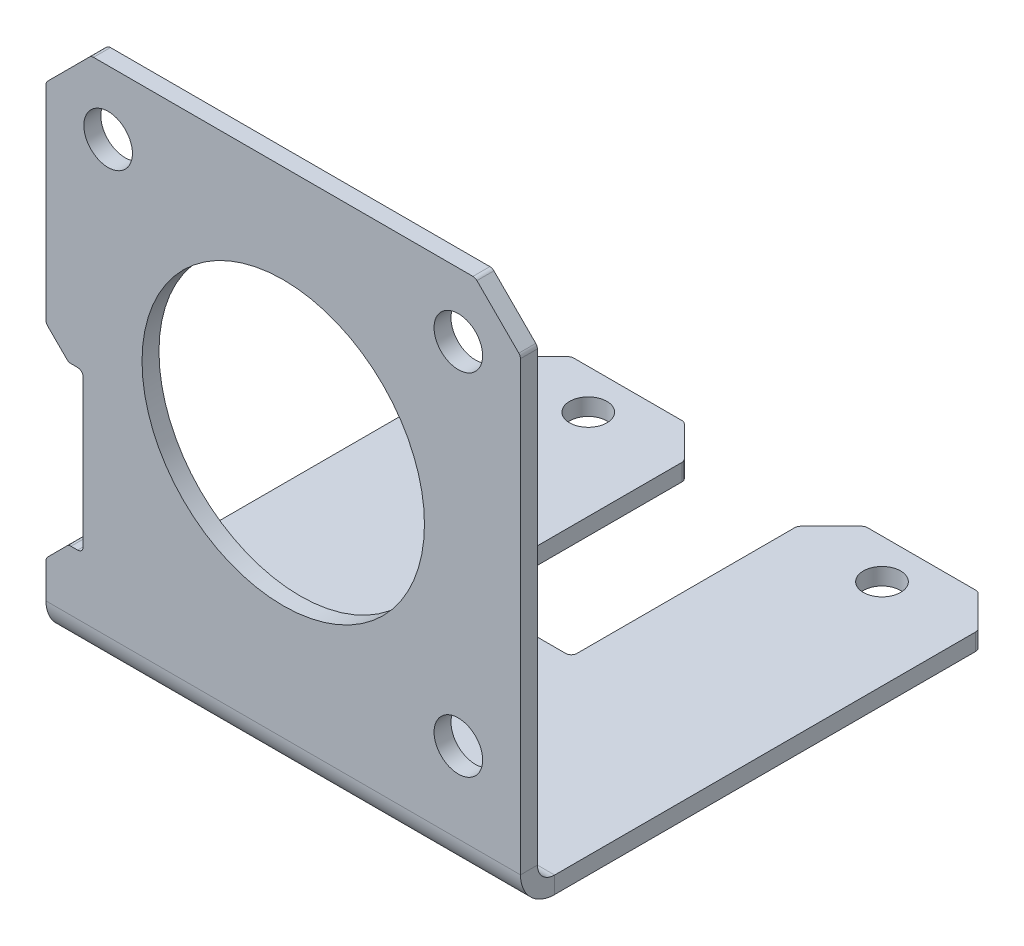
from build123d import *

# Parameters (mm, degrees)
BASE_FLANGE1_DEPTH           = 1.5
EDGE_FLANGE1_STRIP_W         = 9.048
EDGE_FLANGE1_STRIP_H         = 1.5
EDGE_FLANGE1_STRIP_CUT_DEPTH = 42
EDGE_FLANGE1_DEPTH           = 42
SKETCH9_R                    = 12.5
CUT_EXTRUDE1_DEPTH           = 1.5
SKETCH10_R                   = 2.15
CUT_EXTRUDE2_DEPTH           = 67.221899701
SKETCH11_R                   = 1.65
CUT_EXTRUDE3_DEPTH           = 67.221899701
CHAMFER1_SIZE                = 4
CHAMFER2_SIZE                = 3
SKETCH12_W                   = 3.295995972
SKETCH12_H                   = 14
CUT_EXTRUDE4_DEPTH           = 67.221899701
CHAMFER3_SIZE                = 2
SKETCH13_R                   = 1.25
CUT_EXTRUDE5_DEPTH           = 67.221899701
FILLET1_R                    = 0.5


# Sheet-metal steps are written as plain solids
with BuildPart() as part:
    # Sketch1 → Base-Flange1 (new body)
    with BuildSketch(Plane(origin=(0, 0, 0), x_dir=(1, 0, 0), z_dir=(0, 1, 0))):
        Polygon((-21, 43.5), (-5, 43.5), (-5, 20.5), (5, 20.5), (5, 43.5), (21, 43.5), (21, 0), (-21, 0), align=None)
    extrude(amount=-BASE_FLANGE1_DEPTH)

    # Edge-Flange1 strip (across the edge) → Edge-Flange1 strip cut (cut)
    with BuildSketch(Plane(origin=(-21, 0, 0), x_dir=(0, 0, -1), z_dir=(1, 0, 0))):
        with Locations((-1.5, -0.75)):
            Rectangle(EDGE_FLANGE1_STRIP_W, EDGE_FLANGE1_STRIP_H)
    extrude(amount=EDGE_FLANGE1_STRIP_CUT_DEPTH, mode=Mode.SUBTRACT)

    # Edge-Flange1 section (across the edge) → Edge-Flange1 (add)
    with BuildSketch(Plane(origin=(-21, 0, 0), x_dir=(0, 0, -1), z_dir=(1, 0, 0))):
        with BuildLine():
            Line((0, 1.524), (0, 45.3))
            Line((0, 45.3), (1.5, 45.3))
            Line((1.5, 45.3), (1.5, 1.524))
            ThreePointArc((1.5, 1.524), (1.946369265, 0.446369265), (3.024, 0))
            Line((3.024, 0), (3.024, -1.5))
            ThreePointArc((3.024, -1.5), (0.885709094, -0.614290906), (0, 1.524))
        make_face()
    extrude(amount=EDGE_FLANGE1_DEPTH)

    # Sketch9 → Cut-Extrude1 (cut)
    with BuildSketch(Plane.XY):
        with Locations((0, 24.15)):
            Circle(SKETCH9_R)
    extrude(amount=-CUT_EXTRUDE1_DEPTH, mode=Mode.SUBTRACT)

    # Sketch10 → Cut-Extrude2 (cut, through all)
    with BuildSketch(Plane.XY):
        with Locations((-15.5, 39.65)):
            Circle(SKETCH10_R)
        with Locations((15.5, 39.65)):
            Circle(SKETCH10_R)
        with Locations((15.5, 8.65)):
            Circle(SKETCH10_R)
    extrude(amount=-CUT_EXTRUDE2_DEPTH, mode=Mode.SUBTRACT)

    # Sketch11 → Cut-Extrude3 (cut, through all)
    with BuildSketch(Plane(origin=(0, 0, 0), x_dir=(1, 0, 0), z_dir=(0, 1, 0))):
        with Locations(Location((-13, 40, 0), (0, 0, 270))):
            Circle(SKETCH11_R)
        with Locations(Location((13, 40, 0), (0, 0, 90))):
            Circle(SKETCH11_R)
    extrude(amount=-CUT_EXTRUDE3_DEPTH, mode=Mode.SUBTRACT)

    # Chamfer1
    chamfer1_edges = [part.edges().sort_by_distance(p)[0] for p in [
        (-21, 45.3, -0.75),
        (21, 45.3, -0.75),
    ]]
    chamfer(chamfer1_edges, length=CHAMFER1_SIZE)

    # Chamfer2
    chamfer2_edges = [part.edges().sort_by_distance(p)[0] for p in [
        (-21, -0.75, -43.5),
        (-5, -0.75, -43.5),
        (5, -0.75, -43.5),
        (21, -0.75, -43.5),
    ]]
    chamfer(chamfer2_edges, length=CHAMFER2_SIZE)

    # Sketch12 → Cut-Extrude4 (cut, through all)
    with BuildSketch(Plane.XY):
        with Locations((-19.352002014, 13.819078659)):
            Rectangle(SKETCH12_W, SKETCH12_H)
    extrude(amount=-CUT_EXTRUDE4_DEPTH, mode=Mode.SUBTRACT)

    # Chamfer3
    chamfer3_edges = [part.edges().sort_by_distance(p)[0] for p in [
        (-21, 6.819078659, -0.75),
        (-21, 20.819078659, -0.75),
    ]]
    chamfer(chamfer3_edges, length=CHAMFER3_SIZE)

    # Sketch13 → Cut-Extrude5 (cut, through all)
    with BuildSketch(Plane(origin=(0, 0, 0), x_dir=(1, 0, 0), z_dir=(0, 1, 0))):
        with Locations(Location((0, 17.25, 0), (0, 0, 270))):
            Circle(SKETCH13_R)
    extrude(amount=-CUT_EXTRUDE5_DEPTH, mode=Mode.SUBTRACT)

    # Fillet1
    fillet1_edges = [part.edges().sort_by_distance(p)[0] for p in [
        (21, 41.3, -0.75),
        (-8, -0.75, -43.5),
        (-18, -0.75, -43.5),
        (-21, -0.75, -40.5),
        (21, -0.75, -40.5),
        (8, -0.75, -43.5),
        (18, -0.75, -43.5),
        (-5, -0.75, -40.5),
        (5, -0.75, -40.5),
        (-5, -0.75, -20.5),
        (5, -0.75, -20.5),
        (-17.704004028, 20.819078659, -0.75),
        (-17.704004028, 6.819078659, -0.75),
        (-19, 6.819078659, -0.75),
        (-21, 4.819078659, -0.75),
        (-21, 22.819078659, -0.75),
        (-19, 20.819078659, -0.75),
        (-21, 41.3, -0.75),
        (17, 45.3, -0.75),
        (-17, 45.3, -0.75),
    ]]
    fillet(fillet1_edges, radius=FILLET1_R)


solid = part.part
